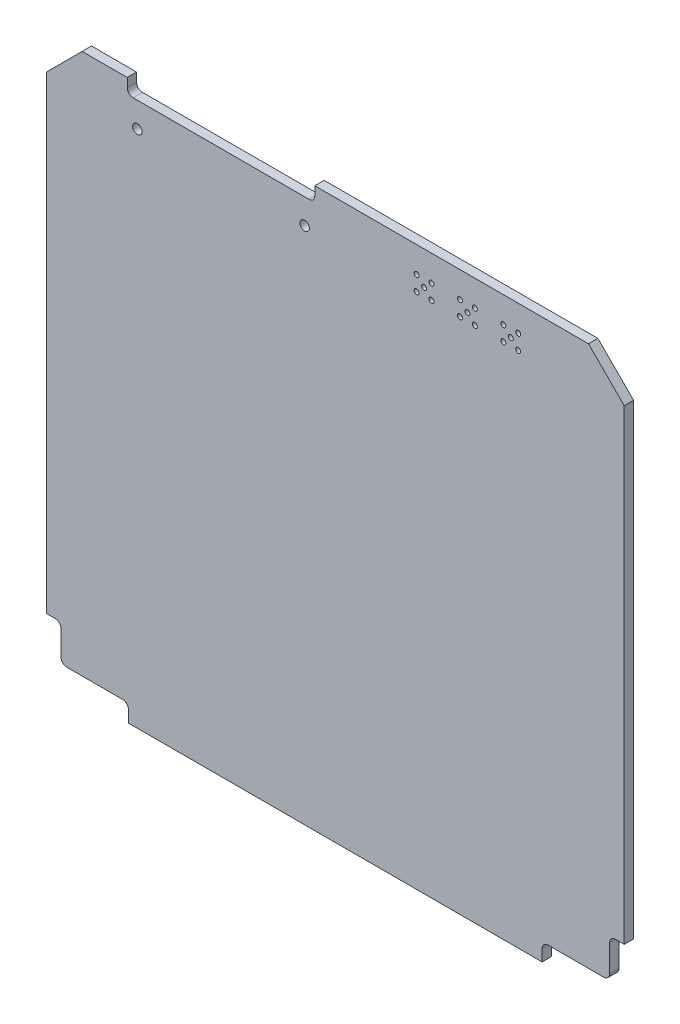
from build123d import *

# Parameters (mm, degrees)
SKETCH1_R           = 0.425
SKETCH1_R_2         = 0.8
BOSS_EXTRUDE1_DEPTH = 1.6


with BuildPart() as part:
    # Sketch1 → Boss-Extrude1 (new body)
    with BuildSketch(Plane(origin=(0, 0, -0.0125), x_dir=(-1, 0, 0), z_dir=(0, 0, -1))):
        with BuildLine():
            Line((47.8, -40.8), (49.3, -40.8))
            Line((49.3, -40.8), (49.3, 39.2))
            Line((49.3, 39.2), (43.2, 45.3))
            Line((43.2, 45.3), (35.500000017, 45.3))
            Line((35.500000017, 45.3), (35.500000017, 43.8))
            ThreePointArc((35.500000017, 43.8), (35.207106799, 43.092893219), (34.500000017, 42.8))
            Line((34.500000017, 42.8), (4.500000014, 42.8))
            ThreePointArc((4.500000014, 42.8), (3.792893232, 43.092893219), (3.500000014, 43.8))
            Line((3.500000014, 43.8), (3.500000014, 45.3))
            Line((3.500000014, 45.3), (-43.2, 45.3))
            Line((-43.2, 45.3), (-49.3, 39.2))
            Line((-49.3, 39.2), (-49.3, -40.4))
            Line((-49.3, -40.4), (-47.8, -40.4))
            ThreePointArc((-47.8, -40.4), (-47.092893219, -40.692893219), (-46.8, -41.4))
            Line((-46.8, -41.4), (-46.8, -46))
            ThreePointArc((-46.8, -46), (-46.507106781, -46.707106781), (-45.8, -47))
            Line((-45.8, -47), (-36.3, -47))
            ThreePointArc((-36.3, -47), (-35.592893219, -47.292893219), (-35.3, -48))
            Line((-35.3, -48), (-35.3, -50))
            Line((-35.3, -50), (35.3, -50))
            Line((35.3, -50), (35.3, -48))
            ThreePointArc((35.3, -48), (35.592893219, -47.292893219), (36.3, -47))
            Line((36.3, -47), (45.8, -47))
            ThreePointArc((45.8, -47), (46.507106781, -46.707106781), (46.8, -46))
            Line((46.8, -46), (46.8, -41.8))
            ThreePointArc((46.8, -41.8), (47.092893219, -41.092893219), (47.8, -40.8))
        make_face()
        with Locations((-13.87, 38.33)):
            Circle(SKETCH1_R, mode=Mode.SUBTRACT)
        with Locations((-22.54, 39.6)):
            Circle(SKETCH1_R, mode=Mode.SUBTRACT)
        with Locations((-23.81, 40.87)):
            Circle(SKETCH1_R, mode=Mode.SUBTRACT)
        with Locations((-21.27, 40.87)):
            Circle(SKETCH1_R, mode=Mode.SUBTRACT)
        with Locations((-13.87, 40.87)):
            Circle(SKETCH1_R, mode=Mode.SUBTRACT)
        with Locations((-31.21, 40.87)):
            Circle(SKETCH1_R, mode=Mode.SUBTRACT)
        with Locations((-16.41, 40.87)):
            Circle(SKETCH1_R, mode=Mode.SUBTRACT)
        with Locations((-15.14, 39.6)):
            Circle(SKETCH1_R, mode=Mode.SUBTRACT)
        with Locations((-29.94, 39.6)):
            Circle(SKETCH1_R, mode=Mode.SUBTRACT)
        with Locations((-28.67, 40.87)):
            Circle(SKETCH1_R, mode=Mode.SUBTRACT)
        with Locations((-28.67, 38.33)):
            Circle(SKETCH1_R, mode=Mode.SUBTRACT)
        with Locations((-16.41, 38.33)):
            Circle(SKETCH1_R, mode=Mode.SUBTRACT)
        with Locations((-21.27, 38.33)):
            Circle(SKETCH1_R, mode=Mode.SUBTRACT)
        with Locations((-23.81, 38.33)):
            Circle(SKETCH1_R, mode=Mode.SUBTRACT)
        with Locations((-31.21, 38.33)):
            Circle(SKETCH1_R, mode=Mode.SUBTRACT)
        with Locations((33.775, 38.54)):
            Circle(SKETCH1_R_2, mode=Mode.SUBTRACT)
        with Locations((5.225, 38.54)):
            Circle(SKETCH1_R_2, mode=Mode.SUBTRACT)
    extrude(amount=-BOSS_EXTRUDE1_DEPTH)


solid = part.part
